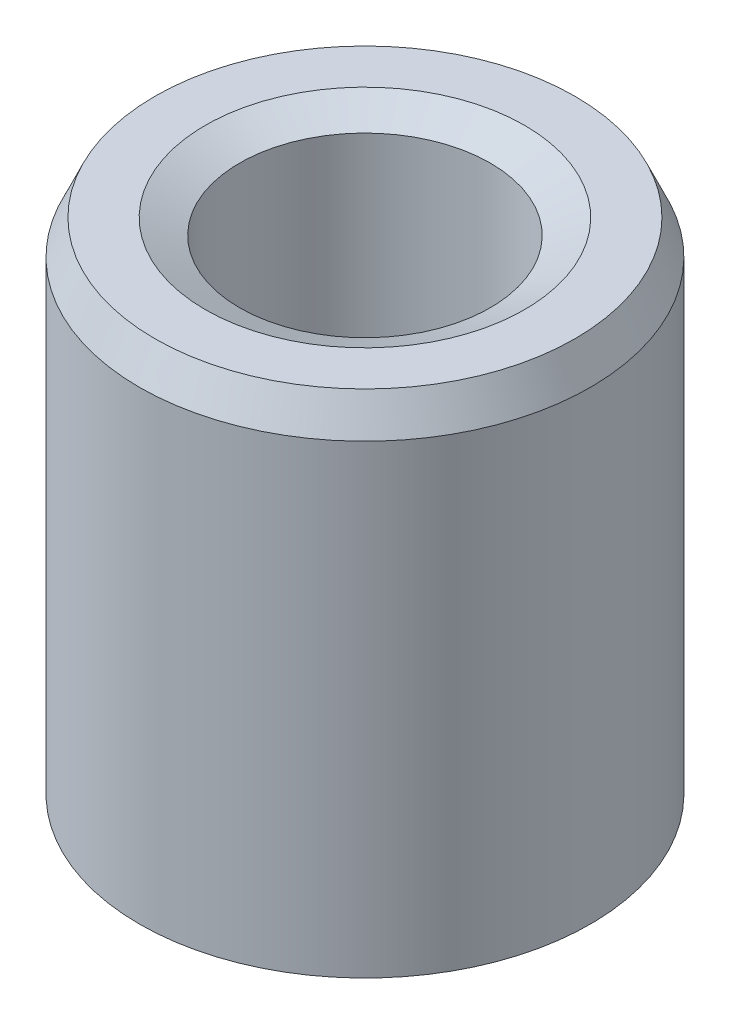
from build123d import *
from OCP.BRepFilletAPI import BRepFilletAPI_MakeChamfer

# Parameters (mm, degrees)
SKETCH1_R           = 5
BOSS_EXTRUDE1_DEPTH = 11.410642137
SKETCH2_R           = 2.779018821
CUT_EXTRUDE1_DEPTH  = 14.423961933
CHAMFER1_SIZE       = 0.76052885
CHAMFER1_SIZE2      = 0.3438904


with BuildPart() as part:
    # Sketch1 → Boss-Extrude1 (new body)
    with BuildSketch(Plane(origin=(0, 0, 0), x_dir=(1, 0, 0), z_dir=(0, 1, 0))):
        Circle(SKETCH1_R)
    extrude(amount=BOSS_EXTRUDE1_DEPTH)

    # Sketch2 → Cut-Extrude1 (cut, through all)
    with BuildSketch(Plane(origin=(0, 0, 0), x_dir=(1, 0, 0), z_dir=(0, 1, 0))):
        Circle(SKETCH2_R)
    extrude(amount=CUT_EXTRUDE1_DEPTH, mode=Mode.SUBTRACT)

    # Chamfer1: one chamfer whose edges measure the first distance from different faces: ONE call of the kernel's chamfer builder (chamfer() names one face for all edges)
    chamfer1_edges_1 = [part.edges().sort_by_distance(p)[0] for p in [
        (-2.779018821, 11.410642137, 0),
    ]]
    chamfer1_side_1 = [part.faces().sort_by_distance(p)[0] for p in [
        (-4.858578644, 11.410642137, 0),
    ]]
    chamfer1_edges_2 = [part.edges().sort_by_distance(p)[0] for p in [
        (-2.779018821, 0, 0),
    ]]
    chamfer1_side_2 = [part.faces().sort_by_distance(p)[0] for p in [
        (-2.779018821, 5.705321069, 0),
    ]]
    chamfer1_edges_3 = [part.edges().sort_by_distance(p)[0] for p in [
        (-5, 0, 0),
    ]]
    chamfer1_side_3 = [part.faces().sort_by_distance(p)[0] for p in [
        (-4.858578644, 0, 0),
    ]]
    chamfer1_edges_4 = [part.edges().sort_by_distance(p)[0] for p in [
        (-5, 11.410642137, 0),
    ]]
    chamfer1_side_4 = [part.faces().sort_by_distance(p)[0] for p in [
        (-5, 5.705321069, 0),
    ]]
    chamfer1 = BRepFilletAPI_MakeChamfer(part.part.solid().wrapped)
    for e in chamfer1_edges_1:
        chamfer1.Add(CHAMFER1_SIZE, CHAMFER1_SIZE2, e.wrapped, chamfer1_side_1[0].wrapped)  # the first distance lies on this face
    for e in chamfer1_edges_2:
        chamfer1.Add(CHAMFER1_SIZE, CHAMFER1_SIZE2, e.wrapped, chamfer1_side_2[0].wrapped)  # the first distance lies on this face
    for e in chamfer1_edges_3:
        chamfer1.Add(CHAMFER1_SIZE, CHAMFER1_SIZE2, e.wrapped, chamfer1_side_3[0].wrapped)  # the first distance lies on this face
    for e in chamfer1_edges_4:
        chamfer1.Add(CHAMFER1_SIZE, CHAMFER1_SIZE2, e.wrapped, chamfer1_side_4[0].wrapped)  # the first distance lies on this face
    add(Compound.cast(chamfer1.Shape()), mode=Mode.REPLACE)


solid = part.part
